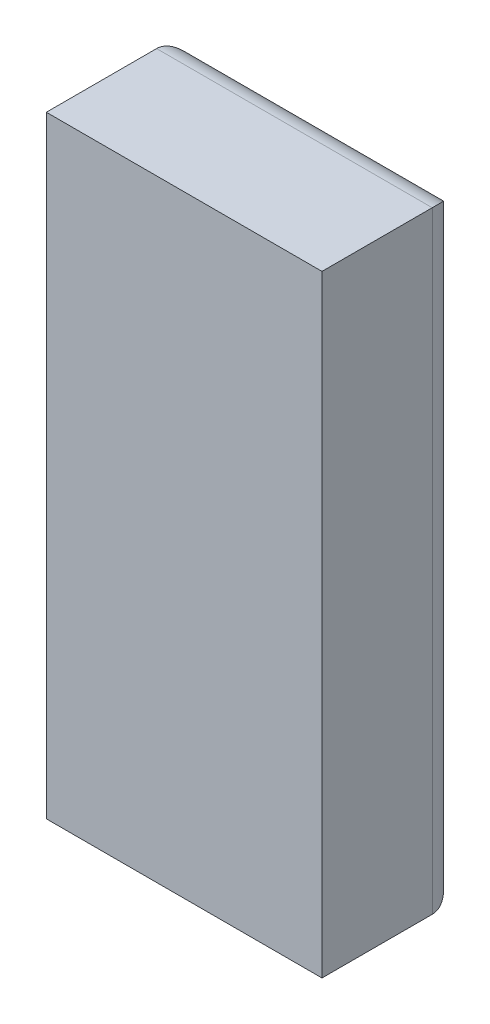
from build123d import *

# Parameters (mm, degrees)
PROFILE_SKETCH_W      = 100
PROFILE_SKETCH_H      = 222
PROFILE_EXTRUDE_DEPTH = 50
FILLET1_R             = 10


with BuildPart() as part:
    # Profile Sketch → Profile Extrude (new body)
    with BuildSketch(Plane.XY):
        Rectangle(PROFILE_SKETCH_W, PROFILE_SKETCH_H)
    extrude(amount=-PROFILE_EXTRUDE_DEPTH)

    # Fillet1
    fillet1_edges = [part.edges().sort_by_distance(p)[0] for p in [
        (0, 111, -50),
        (-50, 0, -50),
        (0, -111, -50),
        (50, 0, -50),
    ]]
    fillet(fillet1_edges, radius=FILLET1_R)


solid = part.part
